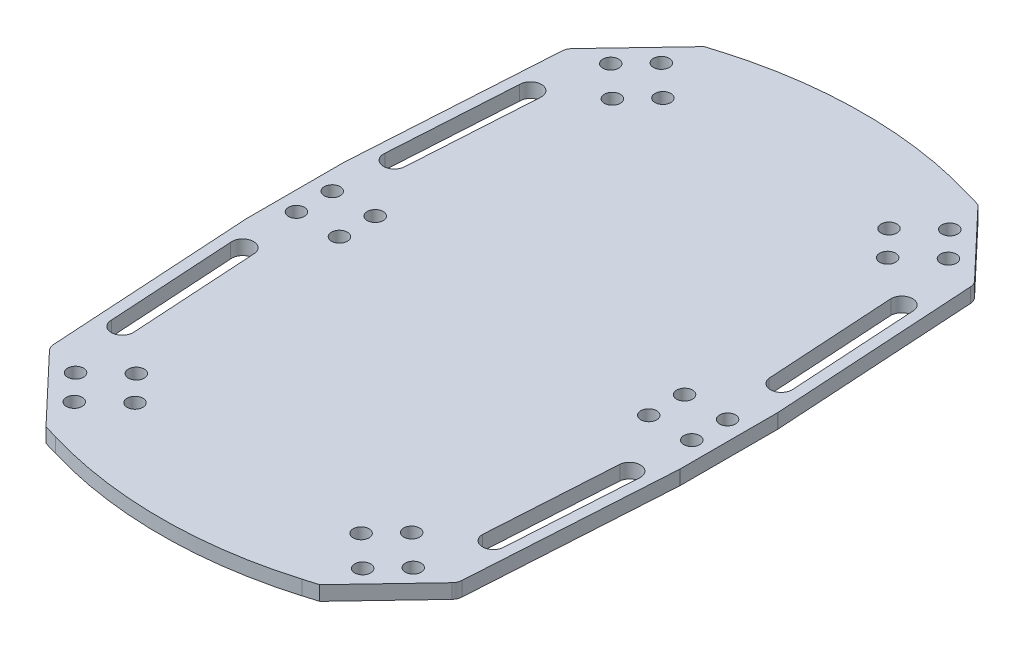
from build123d import *

# Parameters (mm, degrees)
BOSS_EXTRUDE1_DEPTH = 4
SKETCH2_R           = 2.2
CUT_EXTRUDE1_DEPTH  = 1000
FILLET1_R           = 3
MIRROR2_OUTLINE_R   = 2.2
MIRROR2_DEPTH       = 4
FILLET4_R           = 120


# Read off the part's stored shape, not the designer's step: Mirror2
with BuildPart() as part:
    # Sketch1 → Boss-Extrude1 (new body)
    with BuildSketch(Plane(origin=(0, 0, 0), x_dir=(1, 0, 0), z_dir=(0, 1, 0))):
        Polygon((0, 0), (60, 0), (60, 13.5), (56.456743563, 71.5), (37.872574787, 91.086440997), (0, 102.307763512), align=None)
    extrude(amount=BOSS_EXTRUDE1_DEPTH)

    # Sketch2 → Cut-Extrude1 (cut)
    with BuildSketch(Plane(origin=(0, 4, 0), x_dir=(1, 0, 0), z_dir=(0, 1, 0))):
        with Locations(Location((39.912815741, 81.236064514, 0), (0, 0, 270))):
            Circle(SKETCH2_R)
        with Locations(Location((54.7, 4.95, 0), (0, 0, 270))):
            Circle(SKETCH2_R)
        with Locations(Location((31.280273227, 73.045264202, 0), (0, 0, 270))):
            Circle(SKETCH2_R)
        with Locations(Location((42.8, 4.95, 0), (0, 0, 270))):
            Circle(SKETCH2_R)
        with Locations(Location((38.094468445, 65.86356917, 0), (0, 0, 270))):
            Circle(SKETCH2_R)
        with Locations(Location((46.727010958, 74.054369482, 0), (0, 0, 270))):
            Circle(SKETCH2_R)
        with BuildLine():
            Line((56.513876684, 21.365861695), (54.367510102, 56.5))
            ThreePointArc((54.367510102, 56.5), (51.361917218, 59.505592884), (48.356324334, 56.5))
            Line((48.356324334, 56.5), (50.547392357, 20.634138305))
            ThreePointArc((50.547392357, 20.634138305), (53.896496216, 18.016757837), (56.513876684, 21.365861695))
        make_face()
    extrude(amount=-CUT_EXTRUDE1_DEPTH, mode=Mode.SUBTRACT)

    # Fillet1
    # the kernel refuses this fillet: 3 mm, written as the material it takes off along each edge
    with BuildSketch(Plane(origin=(56.456743563, -2.729776757, -71.5), x_dir=(0.060976949232979236, 0, 0.99813917449534), z_dir=(0, 1, 0))) as fillet1_piece_1:
        with BuildLine():
            CenterArc((FILLET1_R * 0.363970234266, -FILLET1_R), FILLET1_R, 90, 40)
            Line((-FILLET1_R * 0.27881737542, -FILLET1_R * 0.233955556881), (0, 0))
            Line((0, 0), (FILLET1_R * 0.363970234266, 0))
        make_face()
    extrude(amount=9.459553514, mode=Mode.SUBTRACT)
    with BuildSketch(Plane(origin=(60, -0.228876509, -13.5), x_dir=(0, 0, 1), z_dir=(0, 1, 0))) as fillet1_piece_2:
        with BuildLine():
            CenterArc((FILLET1_R * 0.0305168678995, -FILLET1_R), FILLET1_R, 90, 3.495890522)
            Line((-FILLET1_R * 0.0304600813334, -FILLET1_R * 0.00186082550466), (0, 0))
            Line((0, 0), (FILLET1_R * 0.0305168678995, 0))
        make_face()
    extrude(amount=4.457753018, mode=Mode.SUBTRACT)

    # Mirror2 outline → Mirror2 (add)
    with BuildSketch(Plane(origin=(0, 0, 0), x_dir=(1, 0, 0), z_dir=(0, 1, 0))):
        with BuildLine():
            Line((60, -13.408449396), (60, 0))
            Line((60, 0), (0, 0))
            Line((0, 0), (0, 102.307763512))
            Line((0, 102.307763512), (-37.872574787, 91.086440997))
            Line((-37.872574787, 91.086440997), (-55.705178644, 72.292097946))
            ThreePointArc((-55.705178644, 72.292097946), (-56.280173438, 71.423240183), (-56.523324946, 70.410121152))
            Line((-56.523324946, 70.410121152), (-59.994417523, 13.591380244))
            ThreePointArc((-59.994417523, 13.591380244), (-59.998604056, 13.4999574), (-60, 13.408449396))
            Line((-60, 13.408449396), (-60, -13.408449396))
            ThreePointArc((-60, -13.408449396), (-59.998604056, -13.4999574), (-59.994417523, -13.591380244))
            Line((-59.994417523, -13.591380244), (-56.523324946, -70.410121152))
            ThreePointArc((-56.523324946, -70.410121152), (-56.280173438, -71.423240183), (-55.705178644, -72.292097946))
            Line((-55.705178644, -72.292097946), (-37.872574787, -91.086440997))
            Line((-37.872574787, -91.086440997), (0, -102.307763512))
            Line((0, -102.307763512), (37.872574787, -91.086440997))
            Line((37.872574787, -91.086440997), (55.705178644, -72.292097946))
            ThreePointArc((55.705178644, -72.292097946), (56.280173438, -71.423240183), (56.523324946, -70.410121152))
            Line((56.523324946, -70.410121152), (59.994417523, -13.591380244))
            ThreePointArc((59.994417523, -13.591380244), (59.998604056, -13.4999574), (60, -13.408449396))
        make_face()
        with Locations((-39.912815741, -81.236064514)):
            Circle(MIRROR2_OUTLINE_R, mode=Mode.SUBTRACT)
        with Locations((-46.727010958, -74.054369482)):
            Circle(MIRROR2_OUTLINE_R, mode=Mode.SUBTRACT)
        with Locations((-38.094468445, -65.86356917)):
            Circle(MIRROR2_OUTLINE_R, mode=Mode.SUBTRACT)
        with Locations((-31.280273227, -73.045264202)):
            Circle(MIRROR2_OUTLINE_R, mode=Mode.SUBTRACT)
        with BuildLine():
            ThreePointArc((-48.356324334, -56.5), (-51.361917218, -59.505592884), (-54.367510102, -56.5))
            Line((-54.367510102, -56.5), (-56.513876684, -21.365861695))
            ThreePointArc((-56.513876684, -21.365861695), (-53.896496215, -18.016757837), (-50.547392357, -20.634138305))
            Line((-50.547392357, -20.634138305), (-48.356324334, -56.5))
        make_face(mode=Mode.SUBTRACT)
        with Locations((-54.7, -4.95)):
            Circle(MIRROR2_OUTLINE_R, mode=Mode.SUBTRACT)
        with Locations((-42.8, -4.95)):
            Circle(MIRROR2_OUTLINE_R, mode=Mode.SUBTRACT)
        with Locations((39.912815741, -81.236064514)):
            Circle(MIRROR2_OUTLINE_R, mode=Mode.SUBTRACT)
        with Locations((31.280273227, -73.045264202)):
            Circle(MIRROR2_OUTLINE_R, mode=Mode.SUBTRACT)
        with Locations((38.094468445, -65.86356917)):
            Circle(MIRROR2_OUTLINE_R, mode=Mode.SUBTRACT)
        with Locations((46.727010958, -74.054369482)):
            Circle(MIRROR2_OUTLINE_R, mode=Mode.SUBTRACT)
        with BuildLine():
            ThreePointArc((54.367510102, -56.5), (51.361917218, -59.505592884), (48.356324334, -56.5))
            Line((48.356324334, -56.5), (50.547392357, -20.634138305))
            ThreePointArc((50.547392357, -20.634138305), (53.896496215, -18.016757837), (56.513876684, -21.365861695))
            Line((56.513876684, -21.365861695), (54.367510102, -56.5))
        make_face(mode=Mode.SUBTRACT)
        with Locations((42.8, -4.95)):
            Circle(MIRROR2_OUTLINE_R, mode=Mode.SUBTRACT)
        with Locations((54.7, -4.95)):
            Circle(MIRROR2_OUTLINE_R, mode=Mode.SUBTRACT)
        with Locations((-54.7, 4.95)):
            Circle(MIRROR2_OUTLINE_R, mode=Mode.SUBTRACT)
        with Locations((-42.8, 4.95)):
            Circle(MIRROR2_OUTLINE_R, mode=Mode.SUBTRACT)
        with BuildLine():
            ThreePointArc((-54.367510102, 56.5), (-51.361917218, 59.505592884), (-48.356324334, 56.5))
            Line((-48.356324334, 56.5), (-50.547392357, 20.634138305))
            ThreePointArc((-50.547392357, 20.634138305), (-53.896496215, 18.016757837), (-56.513876684, 21.365861695))
            Line((-56.513876684, 21.365861695), (-54.367510102, 56.5))
        make_face(mode=Mode.SUBTRACT)
        with Locations((-46.727010958, 74.054369482)):
            Circle(MIRROR2_OUTLINE_R, mode=Mode.SUBTRACT)
        with Locations((-38.094468445, 65.86356917)):
            Circle(MIRROR2_OUTLINE_R, mode=Mode.SUBTRACT)
        with Locations((-31.280273227, 73.045264202)):
            Circle(MIRROR2_OUTLINE_R, mode=Mode.SUBTRACT)
        with Locations((-39.912815741, 81.236064514)):
            Circle(MIRROR2_OUTLINE_R, mode=Mode.SUBTRACT)
    extrude(amount=MIRROR2_DEPTH)

    # Fillet4
    fillet4_edges = [part.edges().sort_by_distance(p)[0] for p in [
        (0, 2, 102.307763512),
        (0, 2, -102.307763512),
    ]]
    fillet(fillet4_edges, radius=FILLET4_R)


solid = part.part
